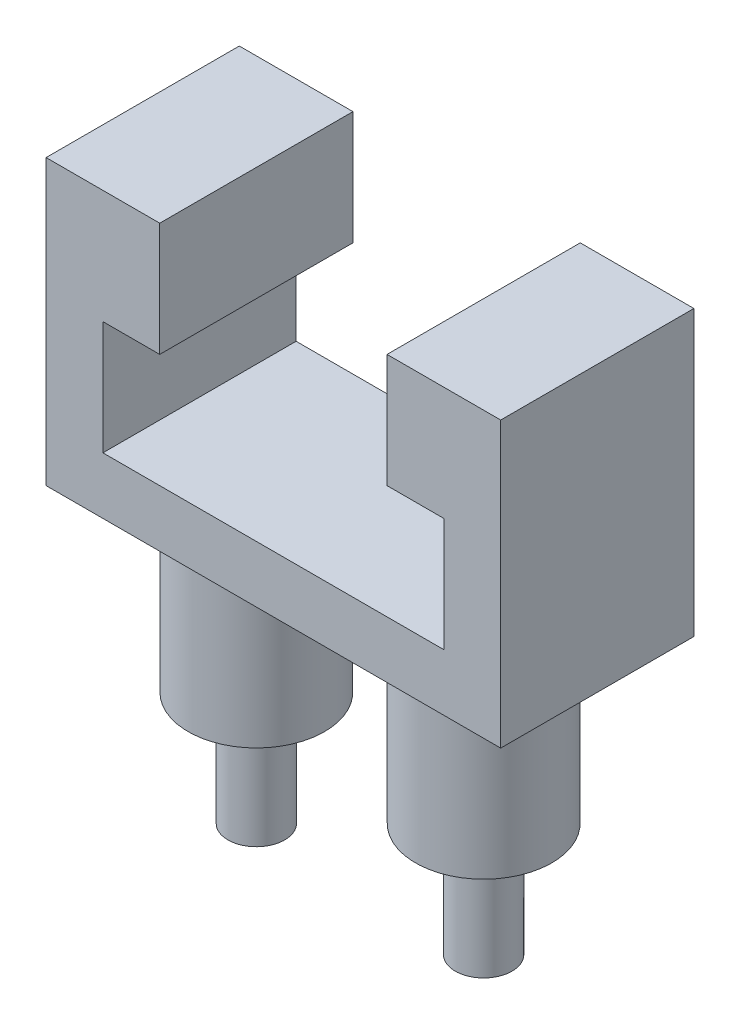
from build123d import *
from build123d.topology import SkipClean

# Parameters (mm, degrees)
SKETCH_3_W               = 32
SKETCH_3_H               = 12
EXTRUDE_3_DEPTH          = 5
SKETCH_4_R               = 5
EXTRUDE_4_DEPTH          = 10
SKETCH_8_R               = 5
EXTRUDE_6_DEPTH          = 5
SKETCH_9_R               = 4.8
CUT_EXTRUDE_2_DEPTH      = 0.5
EXTRUDE_START            = 5
SKETCH_36_R              = 5
SKETCH_36_R_2            = 4.98
EXTRUDE_11_DEPTH         = 5
SKETCH_46_W              = 32
SKETCH_46_H              = 12
EXTRUDE_12_DEPTH         = 20
SKETCH_47_W              = 4
SKETCH_47_H              = 25
EXTRUDE_13_DEPTH         = 12
SKETCH_48_W              = 4
SKETCH_48_H              = 25
EXTRUDE_14_DEPTH         = 12
CUT_EXTRUDE_5_DEPTH      = 46.44227107
CUT_EXTRUDE_5_DEPTH_BACK = 12
SKETCH_50_R              = 6
EXTRUDE_15_DEPTH         = 20
SKETCH_51_R              = 6
EXTRUDE_16_DEPTH         = 20
SKETCH_54_R              = 6
EXTRUDE_17_DEPTH         = 25
SKETCH_55_R              = 6
EXTRUDE_18_DEPTH         = 25
SKETCH_56_R              = 6
CUT_EXTRUDE_6_DEPTH      = 10
SKETCH_57_R              = 2.5
EXTRUDE_19_DEPTH         = 10
SKETCH_58_R              = 6
SKETCH_58_R_2            = 2.5
CUT_EXTRUDE_8_DEPTH      = 10
EXTRUDE_20_DEPTH         = 2.5
EXTRUDE_21_DEPTH         = 2.5


with BuildPart() as part:
    # 草图3 → 凸台-拉伸3 (new body)
    with BuildSketch(Plane(origin=(0, 0, 0), x_dir=(1, 0, 0), z_dir=(0, 1, 0))):
        with Locations((16, 6)):
            Rectangle(SKETCH_3_W, SKETCH_3_H)
    extrude(amount=EXTRUDE_3_DEPTH)

    # 草图4 → 凸台-拉伸4 (add)
    with BuildSketch(Plane.XZ):
        with Locations((6, -6)):
            Circle(SKETCH_4_R)
        with Locations((26, -6)):
            Circle(SKETCH_4_R)
    extrude(amount=EXTRUDE_4_DEPTH)

    # 草图8 → 凸台-拉伸6 (add)
    with BuildSketch(Plane.XZ.offset(10)):
        with Locations((6, -6)):
            Circle(SKETCH_8_R)
    extrude(amount=EXTRUDE_6_DEPTH)

    # 草图9 → 切除-拉伸2 (cut)
    with BuildSketch(Plane.XZ.offset(15)):
        with Locations((6, -6)):
            Circle(SKETCH_9_R)
    extrude(amount=-CUT_EXTRUDE_2_DEPTH, mode=Mode.SUBTRACT)



with BuildPart() as body_2:
    # 草图14 → 旋转2 (revolve)
    with BuildSketch(Plane.XY.offset(-6)):
        Polygon((1.021282046, -20), (1.221282046, -15), (1.021282046, -15), align=None)
    revolve(axis=Axis((6, -15, -6), (0, 1, 0)))


with BuildPart() as part_1:
    add(part.part)

    add(body_2.part)  # 凸台-拉伸11 merges body 2
    # 草图36 → 凸台-拉伸11 (add)
    with BuildSketch(Plane(origin=(0, -20, 0), x_dir=(1, 0, 0), z_dir=(0, 1, 0)).offset(EXTRUDE_START)):
        with Locations((6, 6)):
            Circle(SKETCH_36_R)
        with Locations((6, 6)):
            Circle(SKETCH_36_R_2, mode=Mode.SUBTRACT)
    extrude(amount=-EXTRUDE_11_DEPTH)

    # 草图46 → 凸台-拉伸12 (add)
    with BuildSketch(Plane(origin=(0, 5, 0), x_dir=(1, 0, 0), z_dir=(0, 1, 0))):
        with Locations((16, 6)):
            Rectangle(SKETCH_46_W, SKETCH_46_H)
    extrude(amount=EXTRUDE_12_DEPTH)

    # 草图47 → 凸台-拉伸13 (add)
    with BuildSketch(Plane.XY):
        with Locations((-2, 12.5)):
            Rectangle(SKETCH_47_W, SKETCH_47_H)
    extrude(amount=-EXTRUDE_13_DEPTH)

    # 草图48 → 凸台-拉伸14 (add)
    with BuildSketch(Plane.XY):
        with Locations((34, 12.5)):
            Rectangle(SKETCH_48_W, SKETCH_48_H)
    extrude(amount=-EXTRUDE_14_DEPTH)

    # 草图49 → 切除-拉伸5 (cut, two sides: drawn at the far end of the back side and taken through both)
    with BuildSketch(Plane.XY.offset(-CUT_EXTRUDE_5_DEPTH_BACK)):
        Polygon((26, 143.166538264), (26, 25), (26, 15), (31, 15), (31, 5), (1, 5), (1, 15), (6, 15), (6, 25), (6, 143.166538264), (6, 379.499614792), (26, 379.499614792), align=None)
    extrude(amount=CUT_EXTRUDE_5_DEPTH + CUT_EXTRUDE_5_DEPTH_BACK, mode=Mode.SUBTRACT)

    # 草图50 → 凸台-拉伸15 (add)
    with BuildSketch(Plane.XZ):
        with Locations((6, -6)):
            Circle(SKETCH_50_R)
    extrude(amount=EXTRUDE_15_DEPTH)

    # 草图51 → 凸台-拉伸16 (add)
    with BuildSketch(Plane.XZ):
        with Locations((26, -6)):
            Circle(SKETCH_51_R)
    extrude(amount=EXTRUDE_16_DEPTH)

    # 草图52 → 旋转3 (revolve)
    with SkipClean():  # the faces are left unmerged after this step: merging them gives an invalid solid
        with BuildSketch(Plane.XY.offset(-6)):
            Polygon((0, -20), (0, -25), (0.2, -20), align=None)
        revolve(axis=Axis((6, -20, -6), (0, -1, 0)))

    # 草图53 → 旋转4 (revolve)
    with SkipClean():  # the faces are left unmerged after this step: merging them gives an invalid solid
        with BuildSketch(Plane.XY.offset(-6)):
            Polygon((20, -20), (20, -25), (20.2, -20), align=None)
        revolve(axis=Axis((26, -20, -6), (0, -1, 0)))

    # 草图54 → 凸台-拉伸17 (add)
    with BuildSketch(Plane.XZ):
        with Locations((6, -6)):
            Circle(SKETCH_54_R)
    extrude(amount=EXTRUDE_17_DEPTH)

    # 草图55 → 凸台-拉伸18 (add)
    with BuildSketch(Plane.XZ):
        with Locations((26, -6)):
            Circle(SKETCH_55_R)
    extrude(amount=EXTRUDE_18_DEPTH)

    # 草图56 → 切除-拉伸6 (cut)
    with BuildSketch(Plane.XZ.offset(25)):
        with Locations((6, -6)):
            Circle(SKETCH_56_R)
    extrude(amount=-CUT_EXTRUDE_6_DEPTH, mode=Mode.SUBTRACT)

    # 草图57 → 凸台-拉伸19 (add)
    with BuildSketch(Plane.XZ.offset(15)):
        with Locations((6, -6)):
            Circle(SKETCH_57_R)
    extrude(amount=EXTRUDE_19_DEPTH)

    # 草图58 → 切除-拉伸8 (cut)
    with BuildSketch(Plane.XZ.offset(25)):
        with Locations((26, -6)):
            Circle(SKETCH_58_R)
        with Locations((26, -6)):
            Circle(SKETCH_58_R_2, mode=Mode.SUBTRACT)
    extrude(amount=-CUT_EXTRUDE_8_DEPTH, mode=Mode.SUBTRACT)

    # 草图60 → 凸台-拉伸20 (add)
    with BuildSketch(Plane.XY):
        Polygon((-4, 25), (6, 25), (6, 15), (1, 15), (1, 5), (31, 5), (31, 15), (26, 15), (26, 25), (36, 25), (36, 0), (-4, 0), align=None)
    extrude(amount=EXTRUDE_20_DEPTH)

    # 草图61 → 凸台-拉伸21 (add)
    with BuildSketch(Plane(origin=(0, 0, -12), x_dir=(-1, 0, 0), z_dir=(0, 0, -1))):
        Polygon((-36, 25), (-26, 25), (-26, 15), (-31, 15), (-31, 5), (-1, 5), (-1, 15), (-6, 15), (-6, 25), (4, 25), (4, 0), (-36, 0), align=None)
    extrude(amount=EXTRUDE_21_DEPTH)


solid = part_1.part
